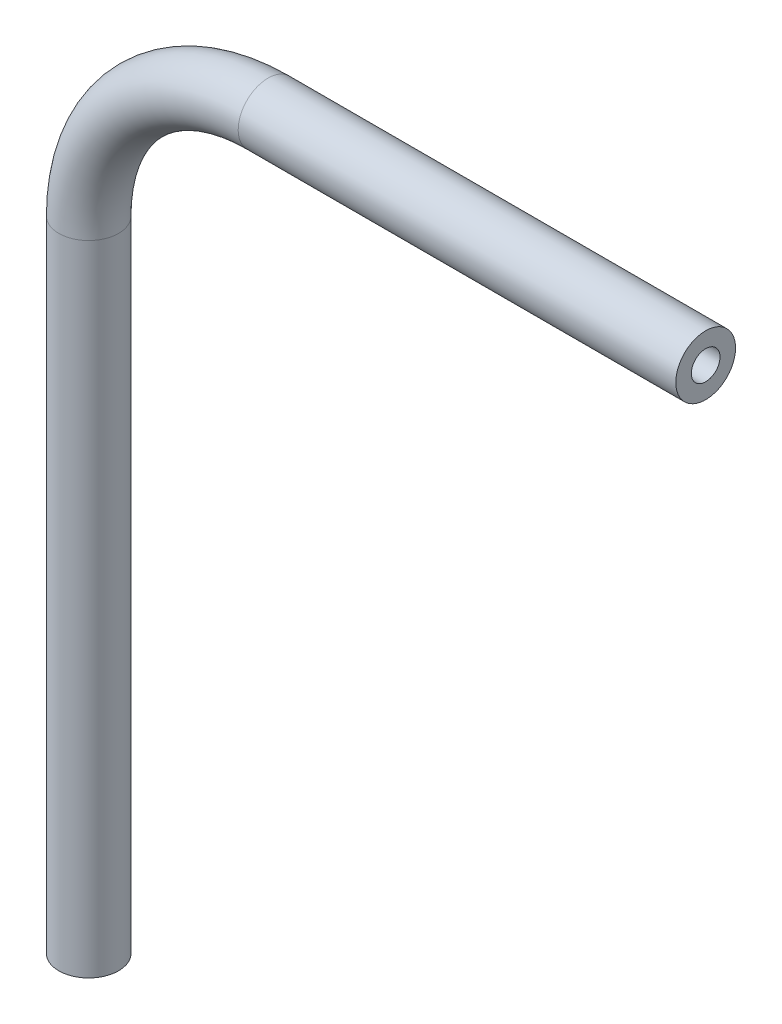
from build123d import *

# Parameters (mm, degrees)
SKETCH2_R   = 3.175
SKETCH2_R_2 = 1.524


with BuildPart() as part:
    # Sweep1: sweep along a path in Sketch1
    with BuildLine(Plane.XY) as sweep1_path:
        Line((0, -69.340317881), (0, -1.522317881))
        ThreePointArc((0, -1.522317881), (5.579615818, 11.948066301), (19.05, 17.527682119))
        Line((19.05, 17.527682119), (65.517903, 17.527682119))
    # Sketch2 → Sweep1 (sweep)
    with BuildSketch(Plane(origin=(65.517903, 17.527682119, 0), x_dir=(0, 0, -1), z_dir=(1, 0, 0))):
        Circle(SKETCH2_R)
        Circle(SKETCH2_R_2, mode=Mode.SUBTRACT)
    sweep(path=sweep1_path.line)


solid = part.part
